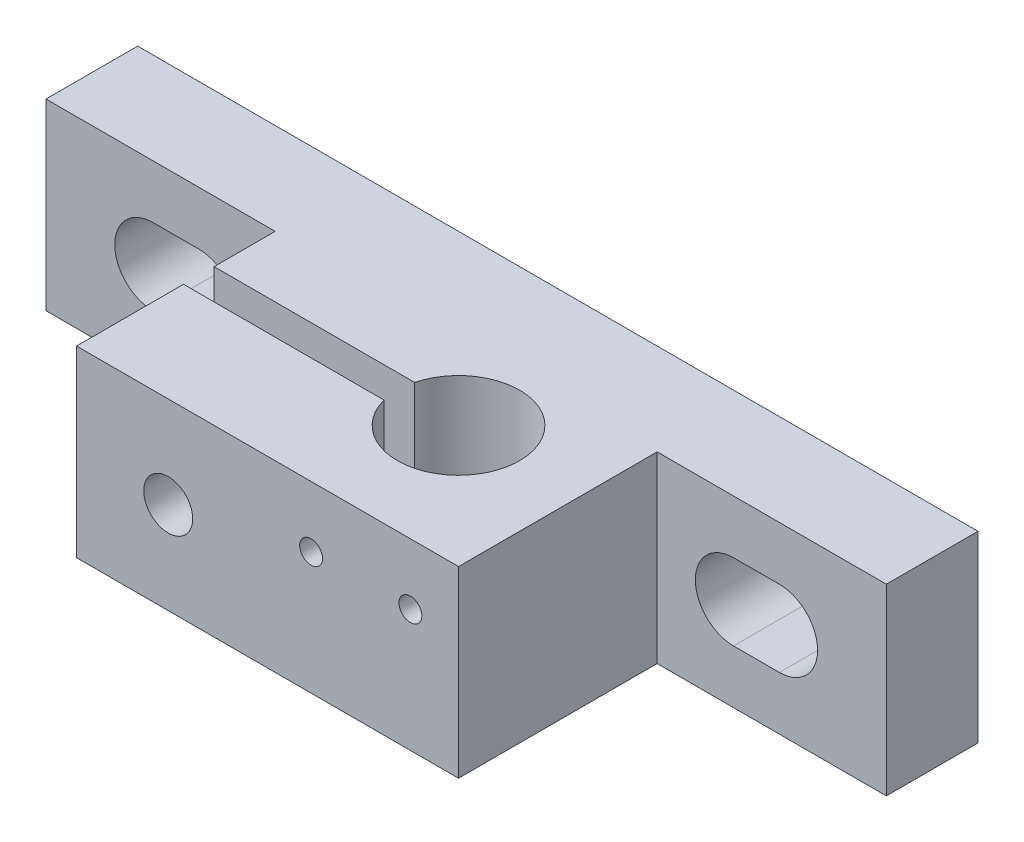
from build123d import *

# Parameters (mm, degrees)
SKETCH2_W           = 55
SKETCH2_H           = 12
BOSS_EXTRUDE1_DEPTH = 6
SKETCH3_W           = 25
SKETCH3_H           = 12
BOSS_EXTRUDE2_DEPTH = 13
CUT_EXTRUDE2_DEPTH  = 30
SKETCH5_W           = 20.513890507
SKETCH5_H           = 7
CUT_EXTRUDE3_DEPTH  = 5
SKETCH6_R           = 1.6
CUT_EXTRUDE4_DEPTH  = 20
CUT_EXTRUDE5_DEPTH  = 3
SKETCH8_R           = 0.75
CUT_EXTRUDE6_DEPTH  = 3


with BuildPart() as part:
    # Sketch2 → Boss-Extrude1 (new body)
    with BuildSketch(Plane.XY):
        with Locations((27.5, 6)):
            Rectangle(SKETCH2_W, SKETCH2_H)
        with BuildLine():
            Line((7, 8.5), (10, 8.5))
            ThreePointArc((10, 8.5), (12.5, 6), (10, 3.5))
            Line((10, 3.5), (7, 3.5))
            ThreePointArc((7, 3.5), (4.5, 6), (7, 8.5))
        make_face(mode=Mode.SUBTRACT)
        with BuildLine():
            Line((48, 8.5), (45, 8.5))
            ThreePointArc((45, 8.5), (42.5, 6), (45, 3.5))
            Line((45, 3.5), (48, 3.5))
            ThreePointArc((48, 3.5), (50.5, 6), (48, 8.5))
        make_face(mode=Mode.SUBTRACT)
    extrude(amount=BOSS_EXTRUDE1_DEPTH)

    # Sketch3 → Boss-Extrude2 (add)
    with BuildSketch(Plane.XY.offset(6)):
        with Locations((27.5, 6)):
            Rectangle(SKETCH3_W, SKETCH3_H)
    extrude(amount=BOSS_EXTRUDE2_DEPTH)

    # Sketch4 → Cut-Extrude2 (cut)
    with BuildSketch(Plane.XZ):
        with BuildLine():
            Line((15, 10), (28.127016654, 10))
            ThreePointArc((28.127016654, 10), (36, 11), (28.127016654, 12))
            Line((28.127016654, 12), (15, 12))
            Line((15, 12), (15, 10))
        make_face()
    extrude(amount=-CUT_EXTRUDE2_DEPTH, mode=Mode.SUBTRACT)

    # Sketch5 → Cut-Extrude3 (cut)
    with BuildSketch(Plane(origin=(0, 0, 0), x_dir=(-1, 0, 0), z_dir=(0, 0, -1))):
        with Locations((-27.415473723, 6)):
            Rectangle(SKETCH5_W, SKETCH5_H)
    extrude(amount=-CUT_EXTRUDE3_DEPTH, mode=Mode.SUBTRACT)

    # Sketch6 → Cut-Extrude4 (cut)
    with BuildSketch(Plane.XY.offset(19)):
        with Locations((21, 6)):
            Circle(SKETCH6_R)
    extrude(amount=-CUT_EXTRUDE4_DEPTH, mode=Mode.SUBTRACT)

    # Sketch7 → Cut-Extrude5 (cut)
    with BuildSketch(Plane(origin=(0, 0, 5), x_dir=(-1, 0, 0), z_dir=(0, 0, -1))):
        Polygon((-17.535898385, 6), (-19.267949192, 9), (-22.732050808, 9), (-24.464101615, 6), (-22.732050808, 3), (-19.267949192, 3), align=None)
    extrude(amount=-CUT_EXTRUDE5_DEPTH, mode=Mode.SUBTRACT)

    # Sketch8 → Cut-Extrude6 (cut)
    with BuildSketch(Plane.XY.offset(19)):
        with Locations((36.85, 8)):
            Circle(SKETCH8_R)
        with Locations((30.35, 8)):
            Circle(SKETCH8_R)
    extrude(amount=-CUT_EXTRUDE6_DEPTH, mode=Mode.SUBTRACT)


solid = part.part
